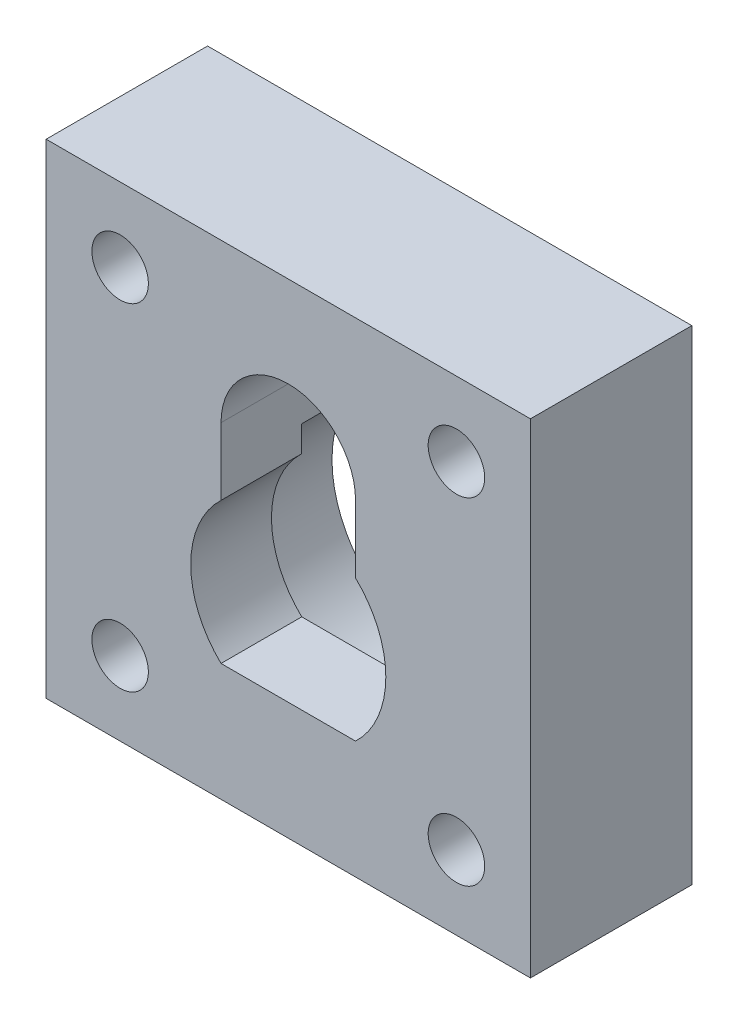
from build123d import *

# Parameters (mm, degrees)
SKETCH1_W             = 36
SKETCH1_H             = 36
BOSS_EXTRUDE1_DEPTH   = 12
SKETCH2_R             = 8.75
CUT_EXTRUDE1_DEPTH    = 6
CUT_EXTRUDE2_REACH    = 28.153
CUT_EXTRUDE3_REACH    = 30.142
M5X0_8_TAPPED_HOLE1_D = 4.2


with BuildPart() as part:
    # Sketch1 → Boss-Extrude1 (new body)
    with BuildSketch(Plane.XY):
        Rectangle(SKETCH1_W, SKETCH1_H)
    extrude(amount=BOSS_EXTRUDE1_DEPTH)

    # Sketch2 → Cut-Extrude1 (cut)
    with BuildSketch(Plane(origin=(0, 0, 0), x_dir=(-1, 0, 0), z_dir=(0, 0, -1))):
        with Locations((0, -4)):
            Circle(SKETCH2_R)
    extrude(amount=-CUT_EXTRUDE1_DEPTH, mode=Mode.SUBTRACT)

    # Sketch3 → Cut-Extrude2 (cut, up to next)
    with BuildSketch(Plane(origin=(0, 0, 6), x_dir=(-1, 0, 0), z_dir=(0, 0, -1)), mode=Mode.PRIVATE) as cut_extrude2_sk1:
        with BuildLine():
            Line((-5, 1.25), (5, 1.25))
            ThreePointArc((5, 1.25), (7.25, -4), (5, -9.25))
            Line((5, -9.25), (-5, -9.25))
            ThreePointArc((-5, -9.25), (-7.25, -4), (-5, 1.25))
        make_face()
    cut_extrude2_tool1 = extrude(cut_extrude2_sk1.sketch, amount=-CUT_EXTRUDE2_REACH, mode=Mode.PRIVATE) & part.part
    add(cut_extrude2_tool1.solids().sort_by_distance((0, -4, 6))[0], mode=Mode.SUBTRACT)

    # Sketch4 → Cut-Extrude3 (cut, up to next)
    with BuildSketch(Plane(origin=(0, 0, 0), x_dir=(-1, 0, 0), z_dir=(0, 0, -1)), mode=Mode.PRIVATE) as cut_extrude3_sk1:
        with BuildLine():
            Line((-5, 6.25), (-5, 1.25))
            Line((-5, 1.25), (5, 1.25))
            Line((5, 1.25), (5, 6.25))
            ThreePointArc((5, 6.25), (0, 11.25), (-5, 6.25))
        make_face()
    cut_extrude3_tool1 = extrude(cut_extrude3_sk1.sketch, amount=-CUT_EXTRUDE3_REACH, mode=Mode.PRIVATE) & part.part
    add(cut_extrude3_tool1.solids().sort_by_distance((0, 5.783251, 0))[0], mode=Mode.SUBTRACT)

    # M5x0.8 Tapped Hole1 (through all)
    with Locations(Plane.XY.offset(12)):
        with Locations((-12.5, -12.5), (12.5, -12.5), (12.5, 12.5), (-12.5, 12.5)):
            Hole(M5X0_8_TAPPED_HOLE1_D / 2)


solid = part.part
